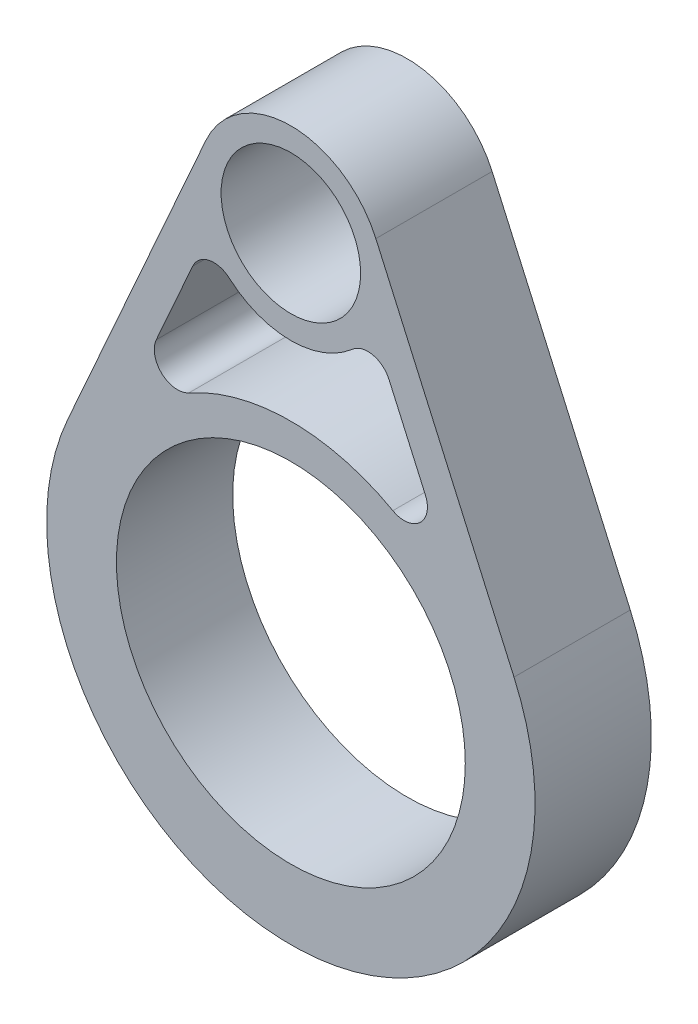
from build123d import *

# Parameters (mm, degrees)
SKETCH1_R               = 75
BOSS_EXTRUDE1_DEPTH     = 25
CUT_EXTRUDE1_DEPTH      = 287.138078556
CUT_EXTRUDE1_DEPTH_BACK = 287.138078556
FILLET1_START           = -25
FILLET1_DEPTH           = 50
SKETCH3_R               = 30
CUT_EXTRUDE2_DEPTH      = 290.39592257


with BuildPart() as part:
    # Sketch1 → Boss-Extrude1 (new, symmetric)
    with BuildSketch(Plane.XY):
        with BuildLine():
            Line((-95.945006832, -117.34375), (-36.550478793, 16.25))
            ThreePointArc((-36.550478793, 16.25), (0, 40), (36.550478793, 16.25))
            Line((36.550478793, 16.25), (95.945006832, -117.34375))
            ThreePointArc((95.945006832, -117.34375), (0, -265), (-95.945006832, -117.34375))
        make_face()
        with Locations((0, -160)):
            Circle(SKETCH1_R, mode=Mode.SUBTRACT)
    extrude(amount=BOSS_EXTRUDE1_DEPTH, both=True)

    # Sketch2 → Cut-Extrude1 (cut, two sides: drawn at the far end of the back side and taken through both)
    with BuildSketch(Plane.XY.offset(-CUT_EXTRUDE1_DEPTH_BACK)):
        with BuildLine():
            Line((-35.52920143, -18.375958363), (-82.238577284, -123.4375))
            ThreePointArc((-82.238577284, -123.4375), (0, -70), (82.238577284, -123.4375))
            Line((82.238577284, -123.4375), (35.52920143, -18.375958363))
            ThreePointArc((35.52920143, -18.375958363), (0, -40), (-35.52920143, -18.375958363))
        make_face()
    extrude(amount=CUT_EXTRUDE1_DEPTH + CUT_EXTRUDE1_DEPTH_BACK, mode=Mode.SUBTRACT)

    # Fillet1: read off the stored shape, not the designer's step
    # Fillet1 outline → Fillet1 (add)
    with BuildSketch(Plane.XY.offset(FILLET1_START)):
        with BuildLine():
            ThreePointArc((-42.220939274, -33.427418189), (-35.213916082, -27.719526256), (-26.466655661, -29.991934551))
            ThreePointArc((-26.466655661, -29.991934551), (-31.537347698, -24.604790188), (-35.52920143, -18.375958363))
            Line((-35.52920143, -18.375958363), (-42.220939274, -33.427418189))
        make_face()
        with BuildLine():
            ThreePointArc((35.52920143, -18.375958363), (31.537347698, -24.604790188), (26.466655661, -29.991934551))
            ThreePointArc((26.466655661, -29.991934551), (35.213916082, -27.719526256), (42.220939274, -33.427418189))
            Line((42.220939274, -33.427418189), (35.52920143, -18.375958363))
        make_face()
        with BuildLine():
            ThreePointArc((-43.853361827, -81.406853629), (-55.469552548, -80.058313703), (-57.863577284, -68.61178181))
            Line((-57.863577284, -68.61178181), (-82.238577284, -123.4375))
            ThreePointArc((-82.238577284, -123.4375), (-66.45628703, -99.30764534), (-43.853361827, -81.406853629))
        make_face()
        with BuildLine():
            Line((82.238577284, -123.4375), (57.863577284, -68.61178181))
            ThreePointArc((57.863577284, -68.61178181), (55.469552548, -80.058313703), (43.853361827, -81.406853629))
            ThreePointArc((43.853361827, -81.406853629), (66.45628703, -99.30764534), (82.238577284, -123.4375))
        make_face()
    extrude(amount=FILLET1_DEPTH)

    # Sketch3 → Cut-Extrude2 (cut, through all)
    with BuildSketch(Plane.XY.offset(25)):
        Circle(SKETCH3_R)
    extrude(amount=-CUT_EXTRUDE2_DEPTH, mode=Mode.SUBTRACT)


solid = part.part
